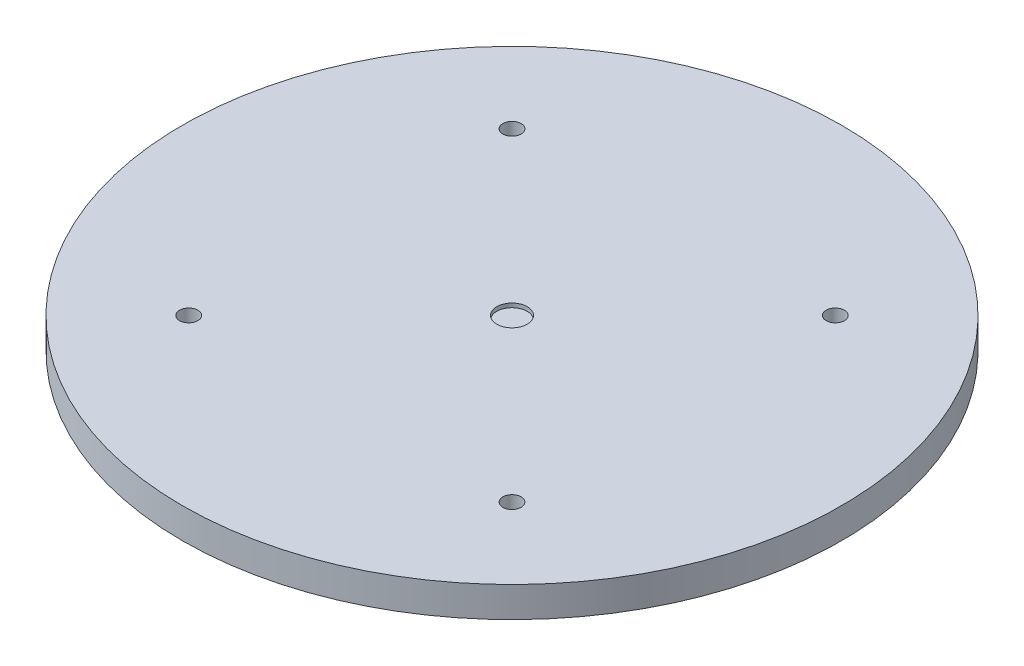
from build123d import *

# Parameters (mm, degrees)
SKETCH1_R           = 82.55
SKETCH1_R_2         = 2.286
BOSS_EXTRUDE2_DEPTH = 7.62
SKETCH2_R           = 3.81
CUT_EXTRUDE1_DEPTH  = 1.016


with BuildPart() as part:
    # Sketch1 → Boss-Extrude2 (new body)
    with BuildSketch(Plane(origin=(0, 0, 0), x_dir=(1, 0, 0), z_dir=(0, 1, 0))):
        Circle(SKETCH1_R)
        with Locations((40.49, 40.49)):
            Circle(SKETCH1_R_2, mode=Mode.SUBTRACT)
        with Locations((40.49, -40.49)):
            Circle(SKETCH1_R_2, mode=Mode.SUBTRACT)
        with Locations((-40.49, -40.49)):
            Circle(SKETCH1_R_2, mode=Mode.SUBTRACT)
        with Locations((-40.49, 40.49)):
            Circle(SKETCH1_R_2, mode=Mode.SUBTRACT)
    extrude(amount=BOSS_EXTRUDE2_DEPTH)

    # Sketch2 → Cut-Extrude1 (cut)
    with BuildSketch(Plane(origin=(0, 7.62, 0), x_dir=(1, 0, 0), z_dir=(0, 1, 0))):
        Circle(SKETCH2_R)
    extrude(amount=-CUT_EXTRUDE1_DEPTH, mode=Mode.SUBTRACT)


solid = part.part
